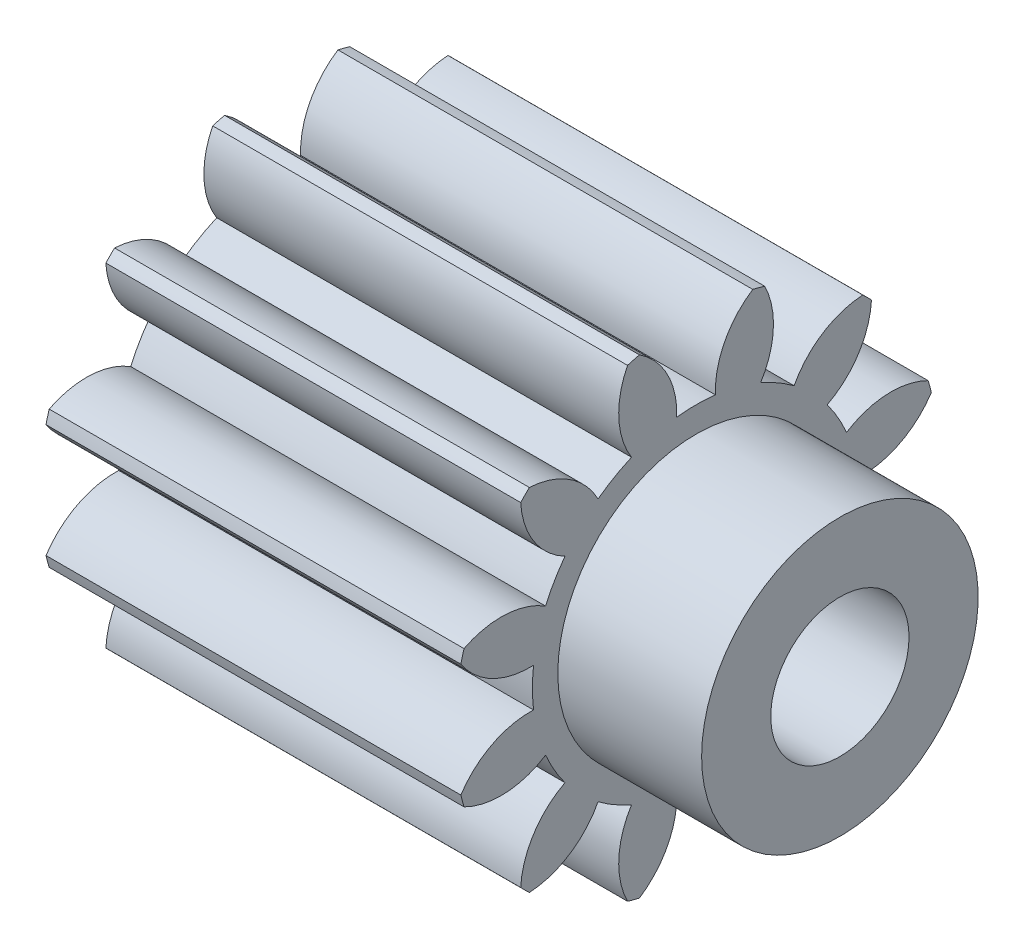
from build123d import *

# Parameters (mm, degrees)
SPUR_START             = -39.027193307
SPUR_GEAR_AI_OUTLINE_R = 1.5875
SPUR_GEAR_AI_DEPTH     = 9.525
SKETCH1_R              = 3.175
SKETCH1_R_2            = 1.5875
BOSS_EXTRUDE1_DEPTH    = 3.302


# Read off the part's stored shape, not the designer's step: spur gear_ai
with BuildPart() as part:
    # spur gear_ai outline → spur gear_ai (new body)
    with BuildSketch(Plane.YZ.offset(SPUR_START)):
        with BuildLine():
            ThreePointArc((11.105383233, 11.622198105), (11.20659768, 11.720869772), (11.305269347, 11.822084219))
            ThreePointArc((11.305269347, 11.822084219), (11.004316623, 12.744174963), (10.288347307, 13.398553922))
            ThreePointArc((10.288347307, 13.398553922), (10.533298325, 13.770131825), (10.732618719, 14.168054581))
            ThreePointArc((10.732618719, 14.168054581), (11.657312179, 13.875196444), (12.60634255, 14.075609112))
            ThreePointArc((12.60634255, 14.075609112), (12.644660999, 14.211668506), (12.679505946, 14.348658621))
            ThreePointArc((12.679505946, 14.348658621), (11.95782787, 14.996736269), (11.010590774, 15.205460412))
            ThreePointArc((11.010590774, 15.205460412), (11.036935627, 15.649731825), (11.010590774, 16.094003238))
            ThreePointArc((11.010590774, 16.094003238), (11.957827869, 16.302727382), (12.679505946, 16.950805029))
            ThreePointArc((12.679505946, 16.950805029), (12.644660999, 17.087795145), (12.60634255, 17.223854538))
            ThreePointArc((12.60634255, 17.223854538), (11.657312179, 17.424267206), (10.732618719, 17.131409069))
            ThreePointArc((10.732618719, 17.131409069), (10.533298325, 17.529331825), (10.288347307, 17.900909728))
            ThreePointArc((10.288347307, 17.900909728), (11.004316623, 18.555288687), (11.305269347, 19.477379431))
            ThreePointArc((11.305269347, 19.477379431), (11.20659768, 19.578593878), (11.105383233, 19.677265545))
            ThreePointArc((11.105383233, 19.677265545), (10.183292489, 19.376312821), (9.52891353, 18.660343505))
            ThreePointArc((9.52891353, 18.660343505), (9.157335627, 18.905294523), (8.759412871, 19.104614918))
            ThreePointArc((8.759412871, 19.104614918), (9.052271007, 20.029308378), (8.85185834, 20.978338749))
            ThreePointArc((8.85185834, 20.978338749), (8.715798946, 21.016657197), (8.57880883, 21.051502144))
            ThreePointArc((8.57880883, 21.051502144), (7.930731183, 20.329824068), (7.722007039, 19.382586973))
            ThreePointArc((7.722007039, 19.382586973), (7.277735627, 19.408931825), (6.833464214, 19.382586973))
            ThreePointArc((6.833464214, 19.382586973), (6.62474007, 20.329824068), (5.976662423, 21.051502144))
            ThreePointArc((5.976662423, 21.051502144), (5.839672308, 21.016657197), (5.703612914, 20.978338749))
            ThreePointArc((5.703612914, 20.978338749), (5.503200246, 20.029308378), (5.796058383, 19.104614918))
            ThreePointArc((5.796058383, 19.104614918), (5.398135627, 18.905294523), (5.026557723, 18.660343505))
            ThreePointArc((5.026557723, 18.660343505), (4.372178765, 19.376312821), (3.45008802, 19.677265545))
            ThreePointArc((3.45008802, 19.677265545), (3.348873574, 19.578593878), (3.250201907, 19.477379431))
            ThreePointArc((3.250201907, 19.477379431), (3.551154631, 18.555288687), (4.267123947, 17.900909728))
            ThreePointArc((4.267123947, 17.900909728), (4.022172929, 17.529331825), (3.822852534, 17.131409069))
            ThreePointArc((3.822852534, 17.131409069), (2.898159074, 17.424267206), (1.949128703, 17.223854538))
            ThreePointArc((1.949128703, 17.223854538), (1.910810254, 17.087795145), (1.875965308, 16.950805029))
            ThreePointArc((1.875965308, 16.950805029), (2.597643384, 16.302727382), (3.544880479, 16.094003238))
            ThreePointArc((3.544880479, 16.094003238), (3.518535627, 15.649731825), (3.544880479, 15.205460412))
            ThreePointArc((3.544880479, 15.205460412), (2.597643384, 14.996736269), (1.875965308, 14.348658621))
            ThreePointArc((1.875965308, 14.348658621), (1.910810254, 14.211668505), (1.949128703, 14.075609112))
            ThreePointArc((1.949128703, 14.075609112), (2.898159074, 13.875196444), (3.822852534, 14.168054581))
            ThreePointArc((3.822852534, 14.168054581), (4.022172929, 13.770131825), (4.267123947, 13.398553922))
            ThreePointArc((4.267123947, 13.398553922), (3.551154631, 12.744174963), (3.250201907, 11.822084219))
            ThreePointArc((3.250201907, 11.822084219), (3.348873574, 11.720869772), (3.45008802, 11.622198105))
            ThreePointArc((3.45008802, 11.622198105), (4.372178765, 11.923150829), (5.026557723, 12.639120145))
            ThreePointArc((5.026557723, 12.639120145), (5.398135627, 12.394169127), (5.796058383, 12.194848732))
            ThreePointArc((5.796058383, 12.194848732), (5.503200246, 11.270155272), (5.703612914, 10.321124901))
            ThreePointArc((5.703612914, 10.321124901), (5.839672308, 10.282806453), (5.976662423, 10.247961506))
            ThreePointArc((5.976662423, 10.247961506), (6.62474007, 10.969639583), (6.833464214, 11.916876678))
            ThreePointArc((6.833464214, 11.916876678), (7.277735627, 11.890531825), (7.722007039, 11.916876678))
            ThreePointArc((7.722007039, 11.916876678), (7.930731183, 10.969639583), (8.57880883, 10.247961506))
            ThreePointArc((8.57880883, 10.247961506), (8.715798946, 10.282806453), (8.85185834, 10.321124901))
            ThreePointArc((8.85185834, 10.321124901), (9.052271007, 11.270155272), (8.759412871, 12.194848732))
            ThreePointArc((8.759412871, 12.194848732), (9.157335627, 12.394169127), (9.52891353, 12.639120145))
            ThreePointArc((9.52891353, 12.639120145), (10.183292489, 11.923150829), (11.105383233, 11.622198105))
        make_face()
        with Locations((7.277735627, 15.649731825)):
            Circle(SPUR_GEAR_AI_OUTLINE_R, mode=Mode.SUBTRACT)
    extrude(amount=SPUR_GEAR_AI_DEPTH)

    # Sketch1 → Boss-Extrude1 (add)
    with BuildSketch(Plane(origin=(-29.502193307, 0, 0), x_dir=(0, 0, -1), z_dir=(1, 0, 0))):
        with Locations(Location((-15.649731825, 7.277735627, 0), (0, 0, 180))):
            Circle(SKETCH1_R)
        with Locations((-15.649731825, 7.277735627)):
            Circle(SKETCH1_R_2, mode=Mode.SUBTRACT)
    extrude(amount=BOSS_EXTRUDE1_DEPTH)


solid = part.part
